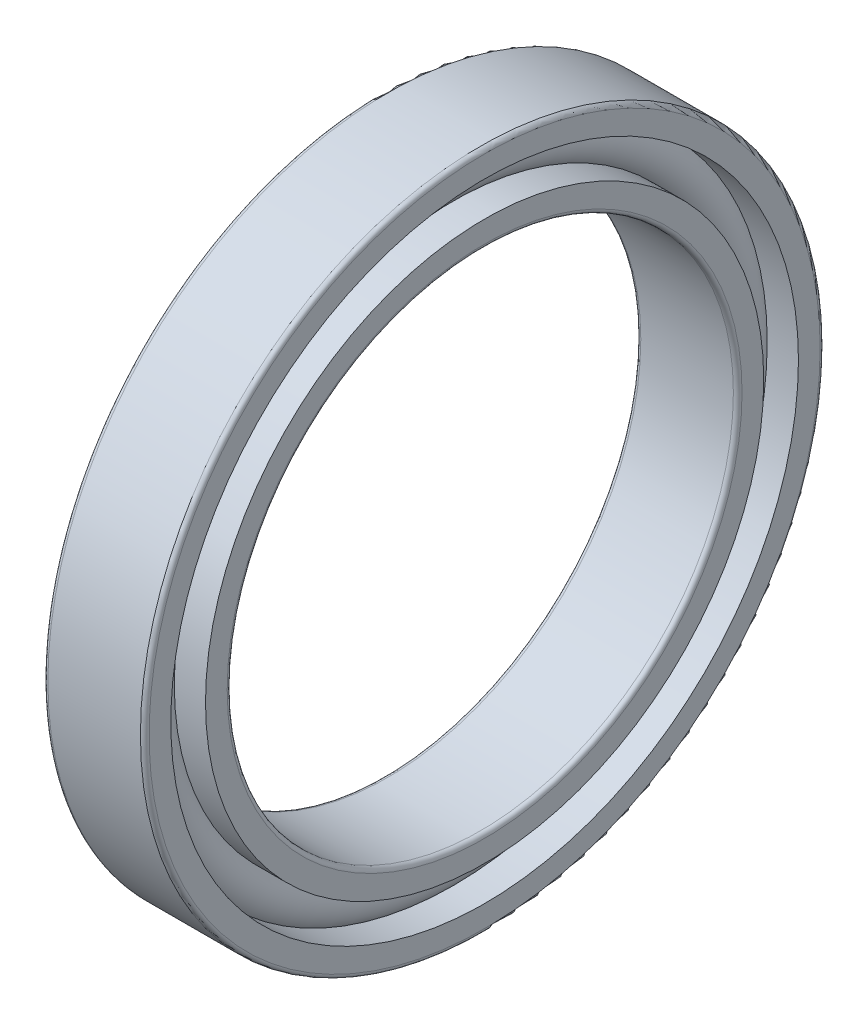
from build123d import *

# Parameters (mm, degrees)
CAGSPISKE_W     = 0.36
CAGSPISKE_H     = 0.6
CAGESPINE_ANGLE = 0.001
BALSIMSKE_R     = 1.8


with BuildPart() as part:
    # CagSpiSke → CageSpine (revolve)
    with BuildSketch(Plane.XY):
        with Locations((0, 20.5)):
            Rectangle(CAGSPISKE_W, CAGSPISKE_H)
    revolve(axis=Axis((-20.6375, 0, 0), (-1, 0, 0)), revolution_arc=CAGESPINE_ANGLE)

    # BalSimSke → BallsSimplified (revolve)
    with BuildSketch(Plane.XY):
        with Locations((0, 20.5)):
            Circle(BALSIMSKE_R)
    revolve(axis=Axis((-10, 0, 0), (1, 0, 0)))

    # InnRacSke → InnerRace (revolve)
    with BuildSketch(Plane.XY):
        with BuildLine():
            Line((-1.307908636, 19.3), (-3.5, 19.3))
            Line((-3.5, 19.3), (-3.5, 17.8))
            ThreePointArc((-3.5, 17.8), (-3.412132034, 17.587867966), (-3.2, 17.5))
            Line((-3.2, 17.5), (3.2, 17.5))
            ThreePointArc((3.2, 17.5), (3.412132034, 17.587867966), (3.5, 17.8))
            Line((3.5, 17.8), (3.5, 19.3))
            Line((3.5, 19.3), (1.307908636, 19.3))
            ThreePointArc((1.307908636, 19.3), (0, 18.725), (-1.307908636, 19.3))
        make_face()
    revolve(axis=Axis((-20.6375, 0, 0), (1, 0, 0)))

    # OutRacSke → OuterRace (revolve)
    with BuildSketch(Plane.XY):
        with BuildLine():
            Line((-1.307908636, 21.7), (-3.5, 21.7))
            Line((-3.5, 21.7), (-3.5, 23.2))
            ThreePointArc((-3.5, 23.2), (-3.412132034, 23.412132034), (-3.2, 23.5))
            Line((-3.2, 23.5), (3.2, 23.5))
            ThreePointArc((3.2, 23.5), (3.412132034, 23.412132034), (3.5, 23.2))
            Line((3.5, 23.2), (3.5, 21.7))
            Line((3.5, 21.7), (1.307908636, 21.7))
            ThreePointArc((1.307908636, 21.7), (0, 22.275), (-1.307908636, 21.7))
        make_face()
    revolve(axis=Axis((-20.6375, 0, 0), (1, 0, 0)))


solid = part.part
